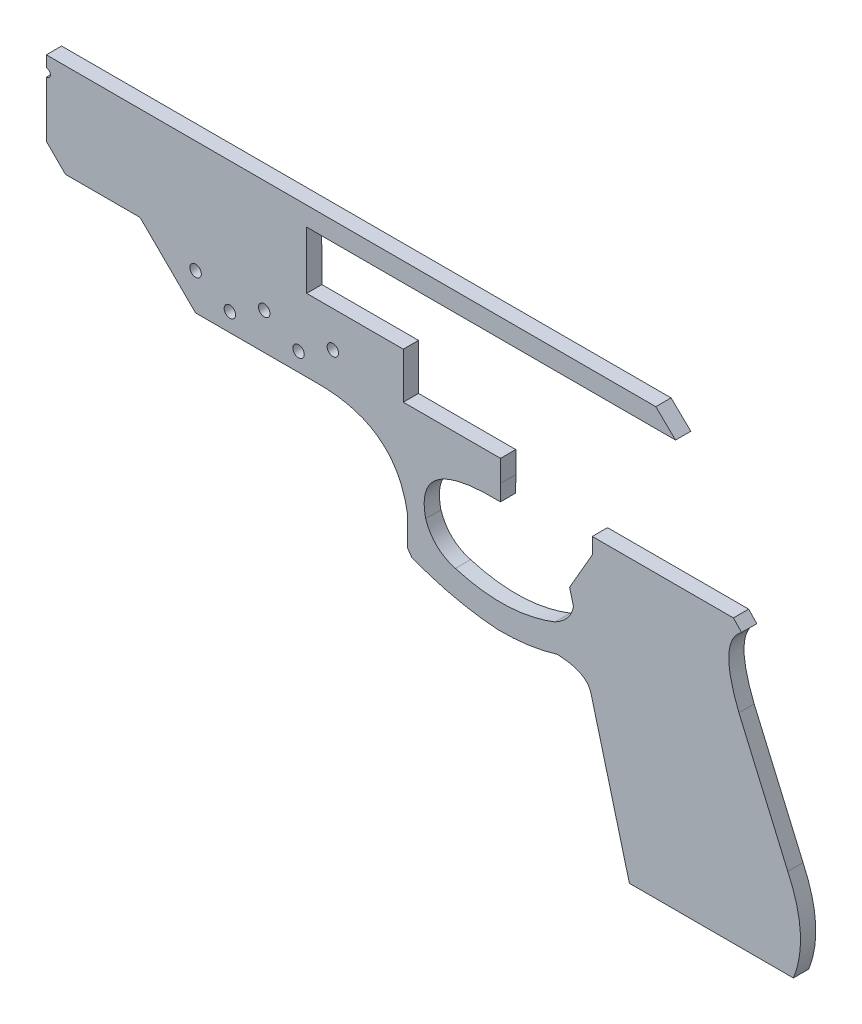
from build123d import *

# Parameters (mm, degrees)
SKETCH1_R           = 15
BOSS_EXTRUDE2_DEPTH = 40


with BuildPart() as part:
    # Sketch1 → Boss-Extrude2 (new body)
    with BuildSketch(Plane.XY):
        with BuildLine():
            Line((2328.193629471, 797.665070151), (2306.644082543, 819.982644122))
            Line((2306.644082543, 819.982644122), (1936.600966183, 819.982644122))
            Line((1936.600966183, 819.982644122), (1936.600966183, 777.982644122))
            Line((1936.600966183, 777.982644122), (1877.049292272, 674.836119232))
            Line((1877.049292272, 674.836119232), (1887.204556022, 636.392194307))
            add(Edge.make_bspline(
                [(1839.028341256, 577.045014524), (1881.43559635, 600.2191041), (1887.204556022, 636.392194307)],
                knots=[0, 0, 0, 0.760505897, 0.760505897, 0.760505897], degree=2))
            add(Edge.make_bspline(
                [(1577.530104584, 567.930861997), (1712.557342233, 527.66528788), (1839.028341256, 577.045014524)],
                knots=[0, 0, 0, 1, 1, 1], degree=2))
            add(Edge.make_bspline(
                [(1499.683598032, 641.815242082), (1519.653389656, 584.068346514), (1577.530104584, 567.930861997)],
                knots=[0, 0, 0, 1, 1, 1], degree=2))
            add(Edge.make_bspline(
                [(1695.292725324, 777.982644122), (1468.390841289, 784.540406299), (1499.683598032, 641.815242082)],
                knots=[0, 0, 0, 1, 1, 1], degree=2))
            Line((1695.292725324, 777.982644122), (1695.773747372, 777.965597041))
            Line((1695.773747372, 777.965597041), (1696.073159669, 819.982644122))
            Line((1696.073159669, 819.982644122), (1696.073159669, 877.037447472))
            Line((1696.073159669, 877.037447472), (1441.073159669, 877.037447472))
            Line((1441.073159669, 877.037447472), (1441.073159669, 997.448610738))
            Line((1441.073159669, 997.448610738), (1187.565465222, 997.448610738))
            Line((1187.565465222, 997.448610738), (1186.991614089, 1147.982644122))
            Line((1186.991614089, 1147.982644122), (2154.99196963, 1147.982644122))
            Line((2154.99196963, 1147.982644122), (2103.235748303, 1197.972230609))
            Line((2103.235748303, 1197.972230609), (504.992691753, 1197.918955745))
            Line((504.992691753, 1197.918955745), (504.992479916, 1168.599995615))
            ThreePointArc((504.992479916, 1168.599995615), (515.673442612, 1157.918954437), (504.992477299, 1147.237915877))
            Line((504.992477299, 1147.237915877), (504.99131138, 1001.506316432))
            Line((504.99131138, 1001.506316432), (554.990911356, 951.505955171))
            Line((554.990911356, 951.505955171), (750.786170947, 951.504540447))
            Line((750.786170947, 951.504540447), (896.36288081, 807.380644179))
            Line((896.36288081, 807.380644179), (1214.094392097, 807.380644179))
            add(Edge.make_bspline(
                [(1452.379086676, 627.629046315), (1422.427096191, 809.110988172), (1214.094392097, 807.380644179)],
                knots=[0, 0, 0, 0.823969697, 0.823969697, 0.823969697], degree=2))
            Line((1452.379086676, 627.629046315), (1452.379086676, 551.12548688))
            Line((1452.379086676, 551.12548688), (1463.316949194, 535.642019159))
            add(Edge.make_bspline(
                [(1463.316949194, 535.642019159), (1573.701640747, 492.381186031), (1689.373161993, 484.664146685)],
                knots=[0, 0, 0, 1, 1, 1], degree=2))
            add(Edge.make_bspline(
                [(1689.373161993, 484.664146685), (1769.523102644, 483.462442752), (1844.488219366, 506.217378346)],
                knots=[0, 0, 0, 1, 1, 1], degree=2))
            add(Edge.make_bspline(
                [(1844.488219366, 506.217378346), (1895.548903244, 504.844258701), (1925.130134309, 490.155237634), (1933.231912571, 462.150315104)],
                knots=[0, 0, 0, 0, 0.72611761, 0.72611761, 0.72611761, 0.72611761], degree=3))
            add(Edge.make_bspline(
                [(1933.231912571, 462.150315104), (1933.460105495, 461.36153455), (1933.671258525, 460.562190341), (1933.865371664, 459.752282477)],
                knots=[0.72611761, 0.72611761, 0.72611761, 0.72611761, 0.746569281, 0.746569281, 0.746569281, 0.746569281], degree=3))
            Line((1933.865371664, 459.752282477), (2033.943360847, 80.895484918))
            Line((2033.943360847, 80.895484918), (2463.943360308, 80.873953568))
            add(Edge.make_bspline(
                [(2449.362223907, 315.534562303), (2507.628902522, 190.098238449), (2463.943360308, 80.873953568)],
                knots=[0, 0, 0, 1, 1, 1], degree=2))
            Line((2449.362223907, 315.534562303), (2321.11971702, 611.9262278))
            add(Edge.make_bspline(
                [(2321.11971702, 611.9262278), (2264.607879649, 751.5529571), (2328.193629471, 797.665070151)],
                knots=[0, 0, 0, 0.701234355, 0.701234355, 0.701234355], degree=2))
        make_face()
        with Locations((986.36288081, 855.380644179)):
            Circle(SKETCH1_R, mode=Mode.SUBTRACT)
        with Locations((896.36288081, 903.380644179)):
            Circle(SKETCH1_R, mode=Mode.SUBTRACT)
        with Locations((1076.36288081, 903.380644179)):
            Circle(SKETCH1_R, mode=Mode.SUBTRACT)
        with Locations((1166.36288081, 855.380644179)):
            Circle(SKETCH1_R, mode=Mode.SUBTRACT)
        with Locations((1256.36288081, 903.380644179)):
            Circle(SKETCH1_R, mode=Mode.SUBTRACT)
    extrude(amount=BOSS_EXTRUDE2_DEPTH)


solid = part.part
